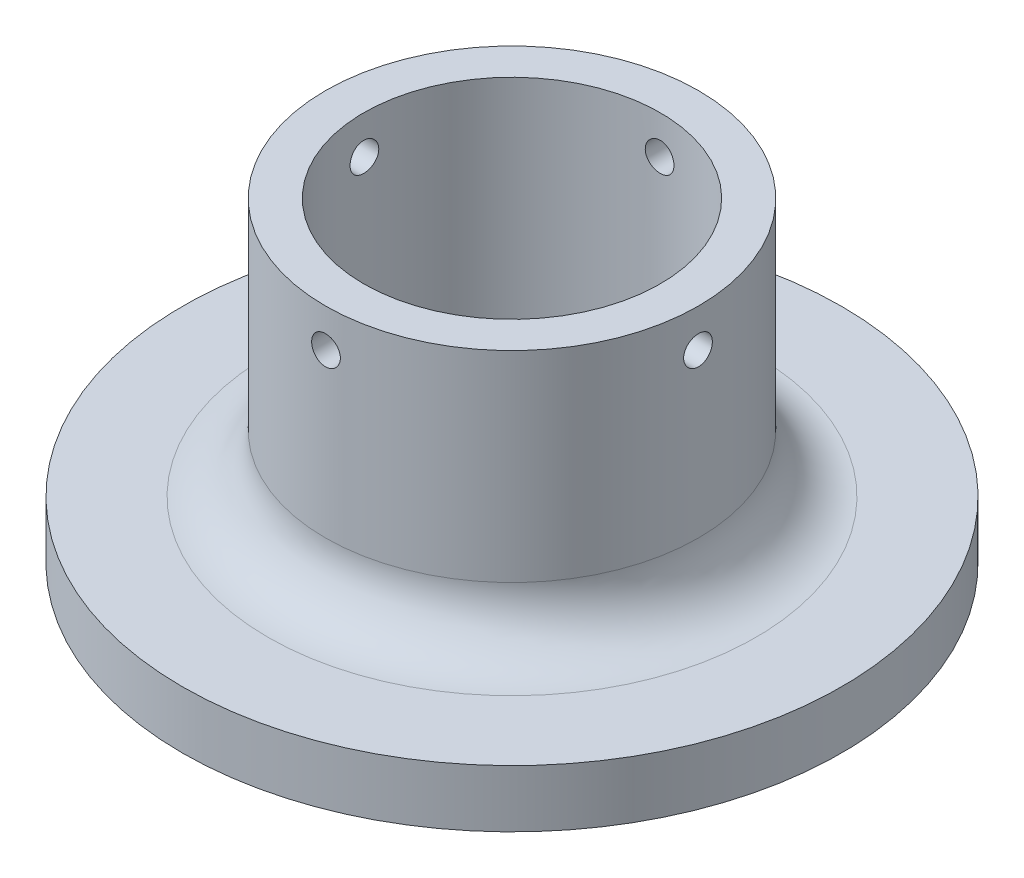
from build123d import *
from build123d.topology import SkipClean

# Parameters (mm, degrees)
CROQUIS1_R              = 17.225
CROQUIS1_R_2            = 7.1
SALIENTE_EXTRUIR1_DEPTH = 3
SALIENTE_EXTRUIR2_START = 3
CROQUIS5_R              = 9.1
CROQUIS5_R_2            = 7.1
SALIENTE_EXTRUIR2_DEPTH = 3
REDONDEO1_R             = 3
CROQUIS10_R             = 1.25
CORTAR_EXTRUIR1_DEPTH   = 1.1
CROQUIS12_R             = 9.75
CROQUIS12_R_2           = 7.75
SALIENTE_EXTRUIR3_DEPTH = 13.5
CROQUIS14_R             = 0.75
CORTAR_EXTRUIR3_DEPTH   = 12
MATRIZC1_COUNT          = 4
REDONDEO2_R             = 3


with BuildPart() as part:
    # Croquis1 → Saliente-Extruir1 (new body)
    with BuildSketch(Plane(origin=(0, 0, 0), x_dir=(1, 0, 0), z_dir=(0, 1, 0))):
        with Locations(Location((0, 0, 0), (0, 0, 270))):
            Circle(CROQUIS1_R)
        with Locations(Location((0, 0, 0), (0, 0, 270))):
            Circle(CROQUIS1_R_2, mode=Mode.SUBTRACT)
    extrude(amount=SALIENTE_EXTRUIR1_DEPTH)

    # Croquis5 → Saliente-Extruir2 (add)
    with SkipClean():  # the faces are left unmerged after this step: merging them gives an invalid solid
        with BuildSketch(Plane.XZ.offset(SALIENTE_EXTRUIR2_START)):
            with Locations(Location((0, 0, 0), (0, 0, 90))):
                Circle(CROQUIS5_R)
            with Locations(Location((0, 0, 0), (0, 0, 270))):
                Circle(CROQUIS5_R_2, mode=Mode.SUBTRACT)
        extrude(amount=-SALIENTE_EXTRUIR2_DEPTH)

    # Redondeo1
    redondeo1_edges = [part.edges().sort_by_distance(p)[0] for p in [
        (0, 0, -9.1),
    ]]
    fillet(redondeo1_edges, radius=REDONDEO1_R - 0.0001)  # a hair under: the kernel refuses the full size

    # Croquis10 → Cortar-Extruir1 (cut)
    with BuildSketch(Plane.XZ):
        with Locations(Location((0, 15.276030829, 0), (0, 0, 270))):
            Circle(CROQUIS10_R)
        with Locations(Location((3.798994383, 14.79610623, 0), (0, 0, 270))):
            Circle(CROQUIS10_R)
        with Locations(Location((7.359283978, 13.38648786, 0), (0, 0, 270))):
            Circle(CROQUIS10_R)
        with Locations(Location((10.457162694, 11.135747226, 0), (0, 0, 270))):
            Circle(CROQUIS10_R)
        with Locations(Location((12.89797942, 8.185306639, 0), (0, 0, 270))):
            Circle(CROQUIS10_R)
        with Locations(Location((14.528368663, 4.720553133, 0), (0, 0, 270))):
            Circle(CROQUIS10_R)
        with Locations(Location((15.245887072, 0.959189912, 0), (0, 0, 270))):
            Circle(CROQUIS10_R)
        with Locations(Location((15.005450325, -2.862442738, 0), (0, 0, 270))):
            Circle(CROQUIS10_R)
        with Locations(Location((13.822165949, -6.504217584, 0), (0, 0, 270))):
            Circle(CROQUIS10_R)
        with Locations(Location((11.770384051, -9.737308519, 0), (0, 0, 270))):
            Circle(CROQUIS10_R)
        with Locations(Location((8.979025635, -12.358568548, 0), (0, 0, 270))):
            Circle(CROQUIS10_R)
        with Locations(Location((5.623482016, -14.203294263, 0), (0, 0, 270))):
            Circle(CROQUIS10_R)
        with Locations(Location((1.91459434, -15.155574764, 0), (0, 0, 270))):
            Circle(CROQUIS10_R)
        with Locations(Location((-1.91459434, -15.155574764, 0), (0, 0, 270))):
            Circle(CROQUIS10_R)
        with Locations(Location((-5.623482016, -14.203294263, 0), (0, 0, 270))):
            Circle(CROQUIS10_R)
        with Locations(Location((-8.979025635, -12.358568548, 0), (0, 0, 270))):
            Circle(CROQUIS10_R)
        with Locations(Location((-11.770384051, -9.737308519, 0), (0, 0, 270))):
            Circle(CROQUIS10_R)
        with Locations(Location((-13.822165949, -6.504217584, 0), (0, 0, 270))):
            Circle(CROQUIS10_R)
        with Locations(Location((-15.005450325, -2.862442738, 0), (0, 0, 270))):
            Circle(CROQUIS10_R)
        with Locations(Location((-15.245887072, 0.959189912, 0), (0, 0, 270))):
            Circle(CROQUIS10_R)
        with Locations(Location((-14.528368663, 4.720553133, 0), (0, 0, 270))):
            Circle(CROQUIS10_R)
        with Locations(Location((-12.89797942, 8.185306639, 0), (0, 0, 270))):
            Circle(CROQUIS10_R)
        with Locations(Location((-10.457162694, 11.135747226, 0), (0, 0, 270))):
            Circle(CROQUIS10_R)
        with Locations(Location((-7.359283978, 13.38648786, 0), (0, 0, 270))):
            Circle(CROQUIS10_R)
        with Locations(Location((-3.798994383, 14.79610623, 0), (0, 0, 270))):
            Circle(CROQUIS10_R)
    extrude(amount=-CORTAR_EXTRUIR1_DEPTH, mode=Mode.SUBTRACT)

    # Croquis12 → Saliente-Extruir3 (add)
    with BuildSketch(Plane(origin=(0, 3, 0), x_dir=(1, 0, 0), z_dir=(0, 1, 0))):
        with Locations(Location((0, 0, 0), (0, 0, 270))):
            Circle(CROQUIS12_R)
        with Locations(Location((0, 0, 0), (0, 0, 270))):
            Circle(CROQUIS12_R_2, mode=Mode.SUBTRACT)
    extrude(amount=SALIENTE_EXTRUIR3_DEPTH)

    # Croquis14 → Cortar-Extruir3 (cut)
    with BuildSketch(Plane(origin=(0, 0, 0), x_dir=(0, 0, -1), z_dir=(1, 0, 0))):
        with Locations((0, 14.5)):
            Circle(CROQUIS14_R)
    cortar_extruir3 = extrude(amount=-CORTAR_EXTRUIR3_DEPTH, mode=Mode.SUBTRACT)

    # MatrizC1: Cortar-Extruir3 ×4 about axis
    matrizc1_axis = Axis((0, 16.5, 0), (0, -1, 0))
    for i in range(1, MATRIZC1_COUNT):
        add(cortar_extruir3.rotate(matrizc1_axis, i * 360 / MATRIZC1_COUNT), mode=Mode.SUBTRACT)

    # Redondeo2
    redondeo2_edges = [part.edges().sort_by_distance(p)[0] for p in [
        (0, 3, -9.75),
    ]]
    fillet(redondeo2_edges, radius=REDONDEO2_R)


solid = part.part
